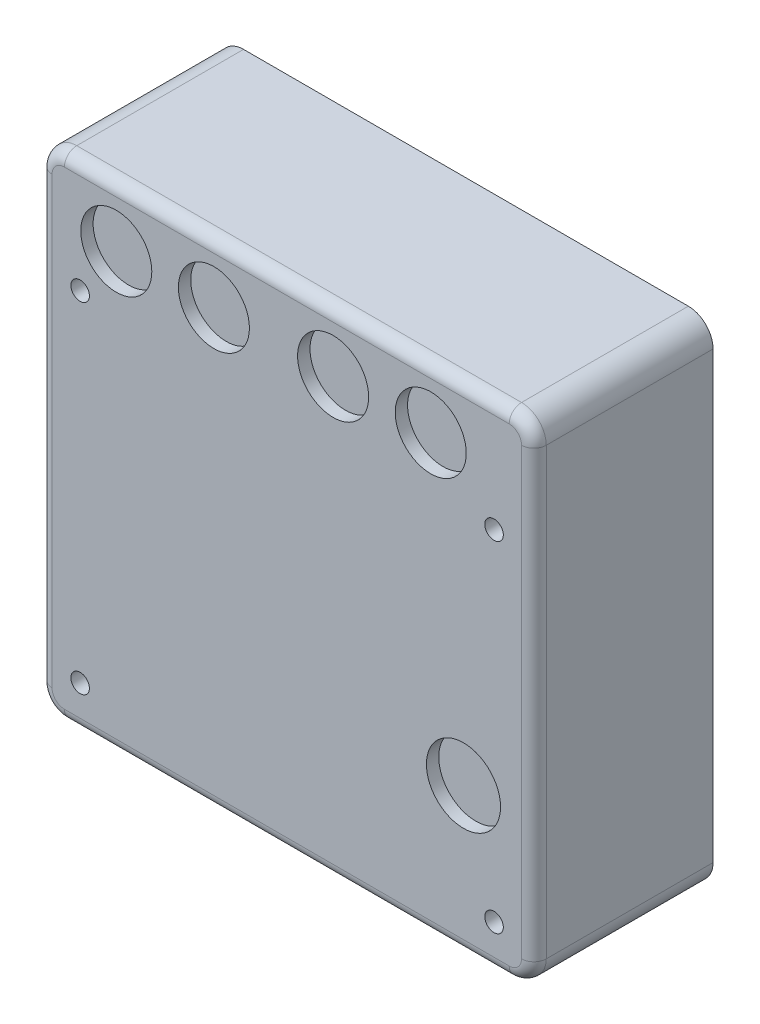
from build123d import *

# Parameters (mm, degrees)
SKETCH1_W           = 80
SKETCH1_H           = 80
BOSS_EXTRUDE1_DEPTH = 14.5
FILLET1_R           = 2
FILLET2_R           = 4
SKETCH2_R           = 5.75
CUT_EXTRUDE1_DEPTH  = 2
SKETCH3_R           = 1.5
CUT_EXTRUDE2_DEPTH  = 12
SKETCH6_R           = 6
CUT_EXTRUDE3_DEPTH  = 2


with BuildPart() as part:
    # Sketch1 → Boss-Extrude1 (new, symmetric)
    with BuildSketch(Plane.XY):
        Rectangle(SKETCH1_W, SKETCH1_H)
    extrude(amount=BOSS_EXTRUDE1_DEPTH, both=True)

    # Fillet1
    fillet1_edges = [part.edges().sort_by_distance(p)[0] for p in [
        (-40, 0, 14.5),
        (0, -40, 14.5),
        (40, 0, 14.5),
        (0, 40, 14.5),
    ]]
    fillet(fillet1_edges, radius=FILLET1_R)

    # Fillet2
    # the kernel refuses this fillet: 4 mm, written as the material it takes off along each edge
    with BuildSketch(Plane(origin=(-36, -36, 14.5), x_dir=(-1, 0, 0), z_dir=(0, 1, 0))) as fillet2_piece_1:
        with BuildLine():
            CenterArc((2, -2), 2, 0, 90)
            Line((4, -2), (4, 0))
            Line((4, 0), (2, 0))
        make_face()
    revolve(axis=Axis((-36, -36, 14.5), (0, 0, 1)), revolution_arc=90, mode=Mode.SUBTRACT)
    with BuildSketch(Plane(origin=(-36, 36, 14.5), x_dir=(0, 1, 0), z_dir=(1, 0, 0))) as fillet2_piece_2:
        with BuildLine():
            CenterArc((2, -2), 2, 0, 90)
            Line((4, -2), (4, 0))
            Line((4, 0), (2, 0))
        make_face()
    revolve(axis=Axis((-36, 36, 14.5), (0, 0, 1)), revolution_arc=90, mode=Mode.SUBTRACT)
    with BuildSketch(Plane(origin=(36, -36, 14.5), x_dir=(0, -1, 0), z_dir=(-1, 0, 0))) as fillet2_piece_3:
        with BuildLine():
            CenterArc((2, -2), 2, 0, 90)
            Line((4, -2), (4, 0))
            Line((4, 0), (2, 0))
        make_face()
    revolve(axis=Axis((36, -36, 14.5), (0, 0, 1)), revolution_arc=90, mode=Mode.SUBTRACT)
    with BuildSketch(Plane(origin=(36, 36, 14.5), x_dir=(1, 0, 0), z_dir=(0, -1, 0))) as fillet2_piece_4:
        with BuildLine():
            CenterArc((2, -2), 2, 0, 90)
            Line((4, -2), (4, 0))
            Line((4, 0), (2, 0))
        make_face()
    revolve(axis=Axis((36, 36, 14.5), (0, 0, 1)), revolution_arc=90, mode=Mode.SUBTRACT)
    with BuildSketch(Plane(origin=(40, 40, 14.5), x_dir=(-1, 0, 0), z_dir=(0, 0, -1)), Plane(origin=(40, -40, 14.5), x_dir=(0, 1, 0), z_dir=(0, 0, -1)), Plane(origin=(-40, -40, -24.5), x_dir=(0, 1, 0), z_dir=(0, 0, 1)), Plane(origin=(-40, 40, -24.5), x_dir=(1, 0, 0), z_dir=(0, 0, 1))) as fillet2_piece_5:
        with BuildLine():
            CenterArc((FILLET2_R, -FILLET2_R), FILLET2_R, 90, 90)
            Line((0, -FILLET2_R), (0, 0))
            Line((0, 0), (FILLET2_R, 0))
        make_face()
    extrude(amount=39, mode=Mode.SUBTRACT)

    # Sketch2 → Cut-Extrude1 (cut)
    with BuildSketch(Plane.XY.offset(14.5)):
        with Locations((-27.6, 30.4)):
            Circle(SKETCH2_R)
        with Locations((-11.8, 30.4)):
            Circle(SKETCH2_R)
        with Locations((7.5, 30.4)):
            Circle(SKETCH2_R)
        with Locations((23.3, 30.4)):
            Circle(SKETCH2_R)
    extrude(amount=-CUT_EXTRUDE1_DEPTH, mode=Mode.SUBTRACT)

    # Sketch3 → Cut-Extrude2 (cut)
    with BuildSketch(Plane.XY.offset(14.5)):
        with Locations((-33.45, 21.95)):
            Circle(SKETCH3_R)
        with Locations((33.55, 21.95)):
            Circle(SKETCH3_R)
        with Locations((-33.45, -33.05)):
            Circle(SKETCH3_R)
        with Locations((33.55, -33.05)):
            Circle(SKETCH3_R)
    extrude(amount=-CUT_EXTRUDE2_DEPTH, mode=Mode.SUBTRACT)

    # Sketch6 → Cut-Extrude3 (cut)
    with BuildSketch(Plane.XY.offset(14.5)):
        with Locations((28.6, -16.4)):
            Circle(SKETCH6_R)
    extrude(amount=-CUT_EXTRUDE3_DEPTH, mode=Mode.SUBTRACT)


solid = part.part
